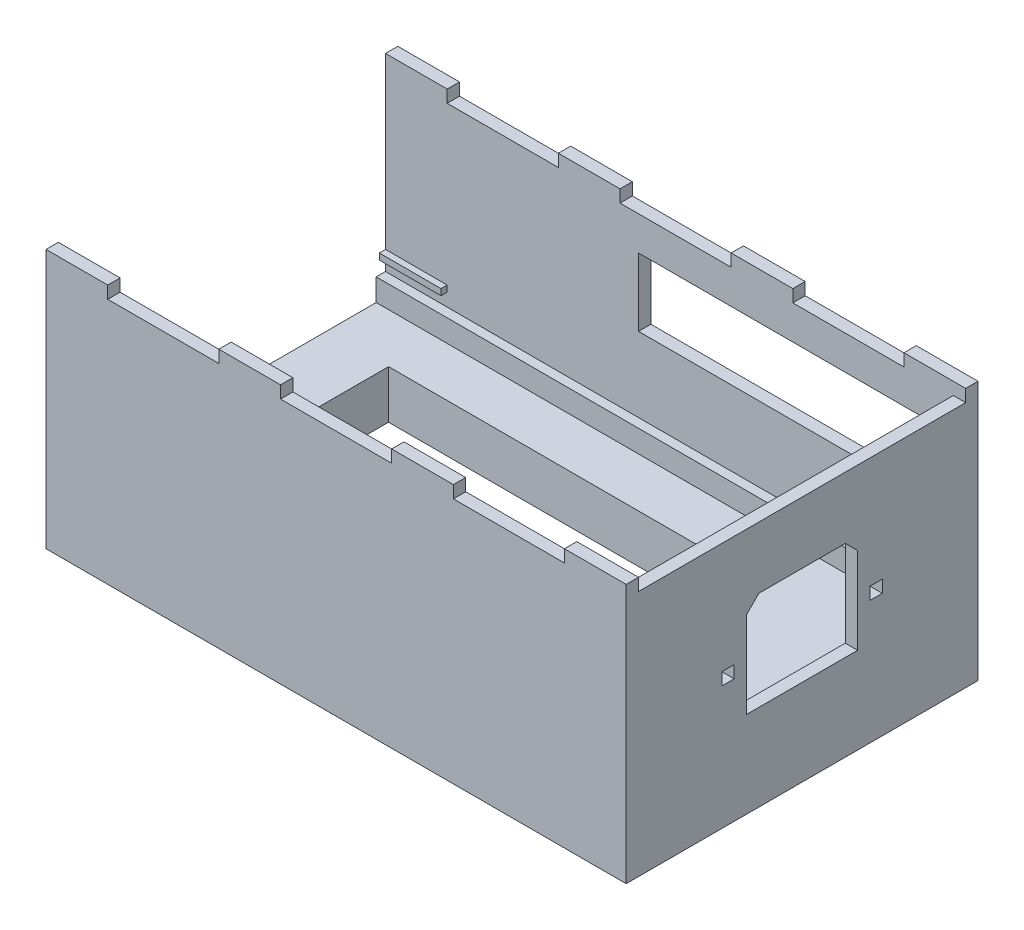
from build123d import *

# Parameters (mm, degrees)
SKETCH1_W               = 94
SKETCH1_H               = 57
BOSS_EXTRUDE1_DEPTH     = 10
BOSS_EXTRUDE2_DEPTH     = 30
SKETCH3_W               = 1.5
SKETCH3_H               = 1.4
SKETCH3_W_2             = 1
SKETCH3_H_2             = 1
BOSS_EXTRUDE3_DEPTH     = 92
SKETCH3_3_W             = 1
SKETCH3_3_H             = 1
BOSS_EXTRUDE4_DEPTH     = 10
SKETCH4_W               = 46
SKETCH4_H               = 11
CUT_EXTRUDE1_DEPTH      = 10
SKETCH5_W               = 2
SKETCH5_H               = 2
CUT_EXTRUDE2_DEPTH      = 2
BOSS_EXTRUDE5_DEPTH     = 2
FILLET1_SIZE            = 1.5
BOSS_EXTRUDE6_DEPTH     = 1
SKETCH9_W               = 10
SKETCH9_H               = 2
BOSS_EXTRUDE7_DEPTH     = 2
CUT_EXTRUDE3_DEPTH      = 79.407264077
CUT_EXTRUDE3_DEPTH_BACK = 79.407264077
SKETCH10_W              = 52
SKETCH10_H              = 34
SKETCH11_W              = 92
SKETCH11_H              = 50
CUT_EXTRUDE4_DEPTH      = 2.2


with BuildPart() as part:
    # Sketch1 → Boss-Extrude1 (new body)
    with BuildSketch(Plane(origin=(0, 0, 0), x_dir=(1, 0, 0), z_dir=(0, 1, 0))):
        with Locations((16.701972288, 4.145945946)):
            Rectangle(SKETCH1_W, SKETCH1_H)
    extrude(amount=BOSS_EXTRUDE1_DEPTH)

    # Sketch2 → Boss-Extrude2 (add)
    with BuildSketch(Plane(origin=(0, 10, 0), x_dir=(1, 0, 0), z_dir=(0, 1, 0))):
        Polygon((-30.298027712, 32.645945946), (63.701972288, 32.645945946), (63.701972288, -24.354054054), (-30.298027712, -24.354054054), (-30.298027712, -22.354054054), (61.701972288, -22.354054054), (61.701972288, 30.645945946), (-30.298027712, 30.645945946), align=None)
    extrude(amount=BOSS_EXTRUDE2_DEPTH)

    # Sketch3 → Boss-Extrude3 (add)
    with BuildSketch(Plane.ZY.offset(30.298027712)):
        with Locations((-29.895945946, 10.7)):
            Rectangle(SKETCH3_W, SKETCH3_H)
        with Locations((21.604054054, 10.7)):
            Rectangle(SKETCH3_W, SKETCH3_H)
        with Locations((21.854054054, 14)):
            Rectangle(SKETCH3_W_2, SKETCH3_H_2)
    extrude(amount=-BOSS_EXTRUDE3_DEPTH)

    # Sketch3<3> → Boss-Extrude4 (add)
    with BuildSketch(Plane.ZY.offset(30.298027712)):
        with Locations((-30.145945946, 14)):
            Rectangle(SKETCH3_3_W, SKETCH3_3_H)
    extrude(amount=-BOSS_EXTRUDE4_DEPTH)

    # Sketch4 → Cut-Extrude1 (cut)
    with BuildSketch(Plane(origin=(0, 0, -32.645945946), x_dir=(-1, 0, 0), z_dir=(0, 0, -1))):
        with Locations((-33.701972288, 29)):
            Rectangle(SKETCH4_W, SKETCH4_H)
    extrude(amount=-CUT_EXTRUDE1_DEPTH, mode=Mode.SUBTRACT)

    # Sketch5 → Cut-Extrude2 (cut)
    with BuildSketch(Plane(origin=(63.701972288, 0, 0), x_dir=(0, 0, -1), z_dir=(1, 0, 0))):
        Polygon((-2.854054054, 30), (11.145945946, 30), (13.145945946, 28), (13.145945946, 14), (-4.854054054, 14), (-4.854054054, 28), align=None)
        with Locations((-7.854054054, 21)):
            Rectangle(SKETCH5_W, SKETCH5_H)
        with Locations((16.145945946, 21)):
            Rectangle(SKETCH5_W, SKETCH5_H)
    extrude(amount=-CUT_EXTRUDE2_DEPTH, mode=Mode.SUBTRACT)

    # Sketch7 → Boss-Extrude5 (add)
    with BuildSketch(Plane(origin=(0, 33, 0), x_dir=(1, 0, 0), z_dir=(0, 1, 0))):
        Polygon((10.701972288, -22.354054054), (61.701972288, -22.354054054), (61.701972288, -20.354054054), (61.701972288, 15.645945946), (59.701972288, 15.645945946), (59.701972288, -20.354054054), (10.701972288, -20.354054054), align=None)
    extrude(amount=-BOSS_EXTRUDE5_DEPTH)

    # Fillet1
    # a fillet whose section is not a circle: 1.5 mm, written as the material it takes off along each edge
    with BuildSketch(Plane(origin=(59.701972288, 31, -19.395945946), x_dir=(1, 0, 0), z_dir=(0, 0, 1))) as fillet1_piece_1:
        with BuildLine():
            Bezier((FILLET1_SIZE, 0), (0, 0), (0, FILLET1_SIZE), weights=[1, 0.353553391, 1])
            Line((0, FILLET1_SIZE), (0, 0))
            Line((0, 0), (FILLET1_SIZE, 0))
        make_face()
    extrude(amount=39.75, mode=Mode.SUBTRACT)
    with BuildSketch(Plane(origin=(59.701972288, 31, 20.354054054), x_dir=(0, 0, 1), z_dir=(-1, 0, 0))) as fillet1_piece_2:
        with BuildLine():
            Bezier((FILLET1_SIZE, 0), (0, 0), (0, FILLET1_SIZE), weights=[1, 0.353553391, 1])
            Line((0, FILLET1_SIZE), (0, 0))
            Line((0, 0), (FILLET1_SIZE, 0))
        make_face()
    extrude(amount=52.75, mode=Mode.SUBTRACT)
    with BuildSketch(Plane(origin=(59.701972288, 31, -19.395945946), x_dir=(1, 0, 0), z_dir=(0, 0, 1))) as fillet1_piece_3a_section:
        with BuildLine():
            Bezier((FILLET1_SIZE, 0), (0, 0), (0, FILLET1_SIZE), weights=[1, 0.353553391, 1])
            Line((0, FILLET1_SIZE), (0, 0))
            Line((0, 0), (FILLET1_SIZE, 0))
        make_face()
    fillet1_piece_3a = extrude(amount=43.5, mode=Mode.PRIVATE)
    fillet1_piece_3a = split(fillet1_piece_3a, bisect_by=Plane(origin=(59.701972288, 31, 22.354054054), z_dir=(0, 0, -1)), keep=Keep.TOP, mode=Mode.PRIVATE)
    fillet1_piece_3a = split(fillet1_piece_3a, bisect_by=Plane(origin=(59.701972288, 31, 20.354054054), z_dir=(0, 0, 1)), keep=Keep.TOP, mode=Mode.PRIVATE)
    with BuildSketch(Plane(origin=(63.451972288, 31, 20.354054054), x_dir=(0, 0, 1), z_dir=(-1, 0, 0))) as fillet1_piece_3b_section:
        with BuildLine():
            Bezier((FILLET1_SIZE, 0), (0, 0), (0, FILLET1_SIZE), weights=[1, 0.353553391, 1])
            Line((0, FILLET1_SIZE), (0, 0))
            Line((0, 0), (FILLET1_SIZE, 0))
        make_face()
    fillet1_piece_3b = extrude(amount=56.5, mode=Mode.PRIVATE)
    fillet1_piece_3b = split(fillet1_piece_3b, bisect_by=Plane(origin=(61.701972288, 31, 20.354054054), z_dir=(-1, 0, 0)), keep=Keep.TOP, mode=Mode.PRIVATE)
    fillet1_piece_3b = split(fillet1_piece_3b, bisect_by=Plane(origin=(59.701972288, 31, 20.354054054), z_dir=(1, 0, 0)), keep=Keep.TOP, mode=Mode.PRIVATE)
    fillet1_piece_3 = fillet1_piece_3a & fillet1_piece_3b
    add(fillet1_piece_3, mode=Mode.SUBTRACT)

    # Sketch8 → Boss-Extrude6 (add)
    with BuildSketch(Plane(origin=(0, 34.8, 0), x_dir=(1, 0, 0), z_dir=(0, 1, 0))):
        Polygon((10.701972288, -20.354054054), (59.701972288, -20.354054054), (59.701972288, 15.645945946), (61.701972288, 15.645945946), (61.701972288, -22.354054054), (10.701972288, -22.354054054), align=None)
    extrude(amount=BOSS_EXTRUDE6_DEPTH)

    # Sketch9 → Boss-Extrude7 (add)
    with BuildSketch(Plane(origin=(0, 40, 0), x_dir=(1, 0, 0), z_dir=(0, 1, 0))):
        with Locations((-25.298027712, 31.645945946)):
            Rectangle(SKETCH9_W, SKETCH9_H)
        with Locations((2.701972288, 31.645945946)):
            Rectangle(SKETCH9_W, SKETCH9_H)
        with Locations((30.701972288, 31.645945946)):
            Rectangle(SKETCH9_W, SKETCH9_H)
        with Locations((58.701972288, 31.645945946)):
            Rectangle(SKETCH9_W, SKETCH9_H)
        with Locations((-25.298027712, -23.354054054)):
            Rectangle(SKETCH9_W, SKETCH9_H)
        with Locations((2.701972288, -23.354054054)):
            Rectangle(SKETCH9_W, SKETCH9_H)
        with Locations((30.701972288, -23.354054054)):
            Rectangle(SKETCH9_W, SKETCH9_H)
        with Locations((58.701972288, -23.354054054)):
            Rectangle(SKETCH9_W, SKETCH9_H)
    extrude(amount=BOSS_EXTRUDE7_DEPTH)

    # Sketch10 → Cut-Extrude3 (cut, two sides: drawn at the far end of the back side and taken through both)
    with BuildSketch(Plane(origin=(0, 10, 0), x_dir=(1, 0, 0), z_dir=(0, 1, 0)).offset(-CUT_EXTRUDE3_DEPTH_BACK)):
        with Locations((5.701972288, 4.145945946)):
            Rectangle(SKETCH10_W, SKETCH10_H)
    extrude(amount=CUT_EXTRUDE3_DEPTH + CUT_EXTRUDE3_DEPTH_BACK, mode=Mode.SUBTRACT)

    # Sketch11 → Cut-Extrude4 (cut)
    with BuildSketch(Plane(origin=(0, 10, 0), x_dir=(1, 0, 0), z_dir=(0, 1, 0))):
        with Locations((15.701972288, 4.145945946)):
            Rectangle(SKETCH11_W, SKETCH11_H)
    extrude(amount=-CUT_EXTRUDE4_DEPTH, mode=Mode.SUBTRACT)


solid = part.part
